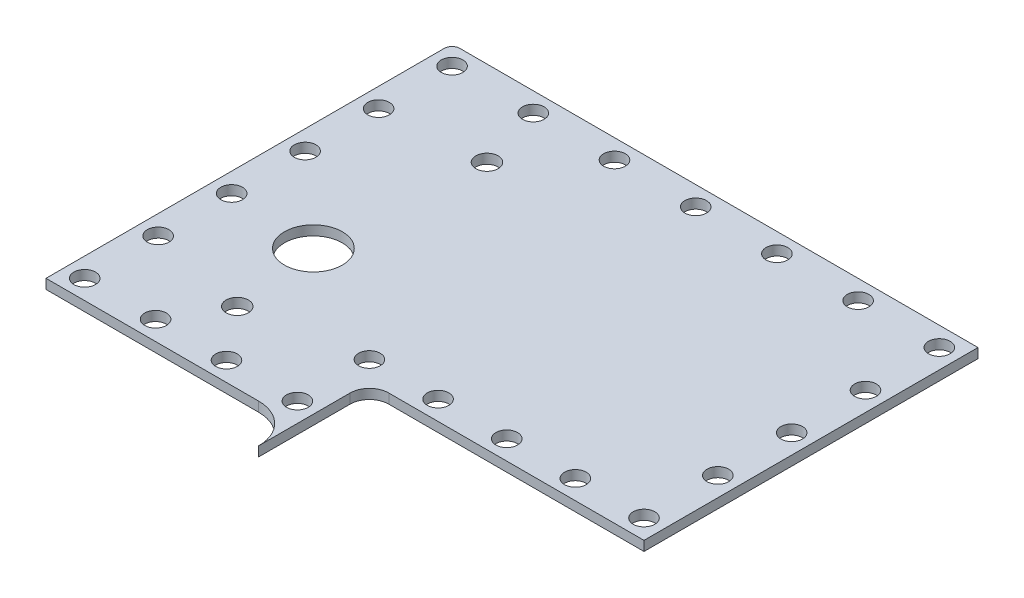
from build123d import *

# Parameters (mm, degrees)
BOSS_EXTRUDE1_DEPTH     = 1.5875
FILLET1_R               = 3.175
CUT_EXTRUDE1_DEPTH      = 86.175847552
CUT_EXTRUDE1_DEPTH_BACK = 86.175847552
SKETCH2_R               = 4.750027573
SKETCH2_R_2             = 1.830008083
CUT_EXTRUDE2_DEPTH      = 86.175847552
CUT_EXTRUDE2_DEPTH_BACK = 86.175847552
SKETCH3_R               = 1.778


with BuildPart() as part:
    # Sketch1 → Boss-Extrude1 (new body)
    with BuildSketch(Plane(origin=(0, 0, 0), x_dir=(1, 0, 0), z_dir=(0, 1, 0))):
        with BuildLine():
            Line((-8.89, -66.675), (-43.815, -66.675))
            Line((-43.815, -66.675), (-43.815, -1.27))
            ThreePointArc((-43.815, -1.27), (-43.443025612, -0.371974388), (-42.545, 0))
            Line((-42.545, 0), (42.545, 0))
            Line((42.545, 0), (42.545, -54.843091388))
            Line((42.545, -54.843091388), (-2.54, -54.843091388))
            Line((-2.54, -54.843091388), (-2.54, -73.025))
            ThreePointArc((-2.54, -73.025), (-4.399871939, -68.534871939), (-8.89, -66.675))
        make_face()
    extrude(amount=BOSS_EXTRUDE1_DEPTH)

    # Fillet1
    fillet1_edges = [part.edges().sort_by_distance(p)[0] for p in [
        (-2.54, 0.79375, 54.843091388),
    ]]
    fillet(fillet1_edges, radius=FILLET1_R)

    # Sketch2 → Cut-Extrude1 (cut, two sides: drawn at the far end of the back side and taken through both)
    with BuildSketch(Plane(origin=(0, 1.5875, 0), x_dir=(-1, 0, 0), z_dir=(0, 1, 0)).offset(-CUT_EXTRUDE1_DEPTH_BACK)):
        with Locations((26.115028378, 40.470331632)):
            Circle(SKETCH2_R)
        with Locations((24.115016768, 54.970415803)):
            Circle(SKETCH2_R_2)
        with Locations((24.114889767, 13.97)):
            Circle(SKETCH2_R_2)
    extrude(amount=CUT_EXTRUDE1_DEPTH + CUT_EXTRUDE1_DEPTH_BACK, mode=Mode.SUBTRACT)

    # Sketch3 → Cut-Extrude2 (cut, two sides: drawn at the far end of the back side and taken through both)
    with BuildSketch(Plane(origin=(0, 1.5875, 0), x_dir=(-1, 0, 0), z_dir=(0, 1, 0)).offset(-CUT_EXTRUDE2_DEPTH_BACK)):
        with Locations((27.305, 3.175)):
            Circle(SKETCH3_R)
        with Locations((13.97, 3.175)):
            Circle(SKETCH3_R)
        with Locations((0.635, 3.175)):
            Circle(SKETCH3_R)
        with Locations((-12.7, 3.175)):
            Circle(SKETCH3_R)
        with Locations((-26.035, 3.175)):
            Circle(SKETCH3_R)
        with Locations((-39.37, 3.175)):
            Circle(SKETCH3_R)
        with Locations((-39.37, 15.298272847)):
            Circle(SKETCH3_R)
        with Locations((-39.37, 27.421545694)):
            Circle(SKETCH3_R)
        with Locations((-39.37, 39.544818541)):
            Circle(SKETCH3_R)
        with Locations((-39.37, 51.668091388)):
            Circle(SKETCH3_R)
        with Locations((-28.09875, 51.668091388)):
            Circle(SKETCH3_R)
        with Locations((-16.8275, 51.668091388)):
            Circle(SKETCH3_R)
        with Locations((-5.55625, 51.668091388)):
            Circle(SKETCH3_R)
        with Locations((5.715, 51.668091388)):
            Circle(SKETCH3_R)
        with Locations((5.715, 63.5)):
            Circle(SKETCH3_R)
        with Locations((17.356666667, 63.5)):
            Circle(SKETCH3_R)
        with Locations((28.998333333, 63.5)):
            Circle(SKETCH3_R)
        with Locations((40.64, 63.5)):
            Circle(SKETCH3_R)
        with Locations((40.64, 51.435)):
            Circle(SKETCH3_R)
        with Locations((40.64, 39.37)):
            Circle(SKETCH3_R)
        with Locations((40.64, 27.305)):
            Circle(SKETCH3_R)
        with Locations((40.64, 15.24)):
            Circle(SKETCH3_R)
        with Locations((40.64, 3.175)):
            Circle(SKETCH3_R)
    extrude(amount=CUT_EXTRUDE2_DEPTH + CUT_EXTRUDE2_DEPTH_BACK, mode=Mode.SUBTRACT)


solid = part.part
